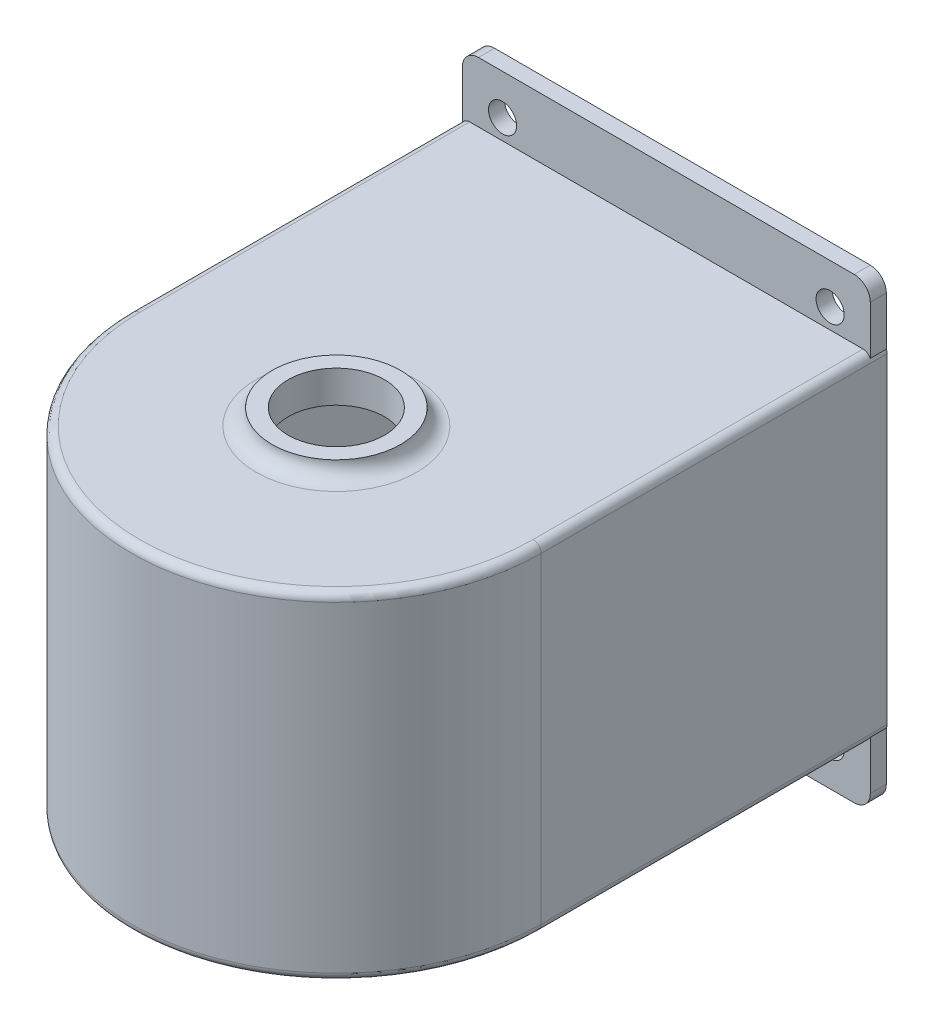
from build123d import *

# Parameters (mm, degrees)
BOSS_EXTRUDE1_DEPTH      = 21
BOSS_EXTRUDE1_DEPTH_BACK = 21
BOSS_EXTRUDE2_START      = -2
BOSS_EXTRUDE2_DEPTH      = 2
BOSS_EXTRUDE3_DEPTH      = 2
FILLET1_R                = 1
SKETCH12_R               = 8
SKETCH12_R_2             = 6
BOSS_EXTRUDE4_DEPTH      = 2
CUT_EXTRUDE1_START       = -11
SKETCH14_R               = 6
CUT_EXTRUDE1_DEPTH       = 11
FILLET2_R                = 2
SKETCH15_W               = 50.8
SKETCH15_H               = 57
BOSS_EXTRUDE5_DEPTH      = 2
FILLET3_R                = 2
SKETCH16_R               = 15
SKETCH16_R_2             = 7.05
CUT_EXTRUDE2_DEPTH       = 1
SKETCH16_3_R             = 7.05
CUT_EXTRUDE3_DEPTH       = 3
FILLET4_R                = 0.5
SKETCH17_R               = 1.75
CUT_EXTRUDE4_DEPTH       = 10


with BuildPart() as part:
    # Sketch7 → Boss-Extrude1 (new, two sides: drawn at the far end of the back side and taken through both)
    with BuildSketch(Plane(origin=(0, -3.5, 0), x_dir=(1, 0, 0), z_dir=(0, 1, 0)).offset(-BOSS_EXTRUDE1_DEPTH_BACK)):
        with BuildLine():
            Line((-23.5, 43.1), (-25.4, 43.1))
            Line((-25.4, 43.1), (-25.5, 43.1))
            Line((-25.5, 43.1), (-25.5, 0))
            ThreePointArc((-25.5, 0), (0, -25.5), (25.5, 0))
            Line((25.5, 0), (25.5, 43.1))
            Line((25.5, 43.1), (25.4, 43.1))
            Line((25.4, 43.1), (23.5, 43.1))
            Line((23.5, 43.1), (23.5, 0))
            ThreePointArc((23.5, 0), (0, -23.5), (-23.5, 0))
            Line((-23.5, 0), (-23.5, 43.1))
        make_face()
    extrude(amount=BOSS_EXTRUDE1_DEPTH + BOSS_EXTRUDE1_DEPTH_BACK)

    # Sketch8 → Boss-Extrude2 (add)
    with BuildSketch(Plane(origin=(0, 17.5, 0), x_dir=(1, 0, 0), z_dir=(0, 1, 0)).offset(BOSS_EXTRUDE2_START)):
        with BuildLine():
            Line((-25.5, 0), (-25.5, 43.1))
            Line((-25.5, 43.1), (25.5, 43.1))
            Line((25.5, 43.1), (25.5, 0))
            ThreePointArc((25.5, 0), (0, -25.5), (-25.5, 0))
        make_face()
    extrude(amount=BOSS_EXTRUDE2_DEPTH)

    # Sketch10 → Boss-Extrude3 (add)
    with BuildSketch(Plane.XZ.offset(24.5)):
        with BuildLine():
            Line((-23.5, 0), (-23.5, -43.1))
            Line((-23.5, -43.1), (23.5, -43.1))
            Line((23.5, -43.1), (23.5, 0))
            ThreePointArc((23.5, 0), (0, 23.5), (-23.5, 0))
        make_face()
        with BuildLine():
            ThreePointArc((25.5, 0), (0, 25.5), (-25.5, 0))
            Line((-25.5, 0), (-25.5, -43.1))
            Line((-25.5, -43.1), (-23.5, -43.1))
            Line((-23.5, -43.1), (-23.5, 0))
            ThreePointArc((-23.5, 0), (0, 23.5), (23.5, 0))
            Line((23.5, 0), (23.5, -43.1))
            Line((23.5, -43.1), (25.5, -43.1))
            Line((25.5, -43.1), (25.5, 0))
        make_face()
    extrude(amount=-BOSS_EXTRUDE3_DEPTH)

    # Fillet1
    fillet1_edges = [part.edges().sort_by_distance(p)[0] for p in [
        (0, 17.5, 25.5),
        (25.5, 17.5, -21.55),
        (25.5, -24.5, -21.55),
        (0, -24.5, 25.5),
        (-25.5, -24.5, -21.55),
        (0, 15.5, 23.5),
        (23.5, 15.5, -21.55),
        (-23.5, 15.5, -21.55),
        (-25.5, 17.5, -21.55),
        (23.5, -22.5, -21.55),
        (0, -22.5, 23.5),
        (-23.5, -22.5, -21.55),
    ]]
    fillet(fillet1_edges, radius=FILLET1_R)

    # Sketch12 → Boss-Extrude4 (add)
    with BuildSketch(Plane(origin=(0, 17.5, 0), x_dir=(1, 0, 0), z_dir=(0, 1, 0))):
        with Locations(Location((0, 0, 0), (0, 0, 270))):
            Circle(SKETCH12_R)
        with Locations(Location((0, 0, 0), (0, 0, 270))):
            Circle(SKETCH12_R_2, mode=Mode.SUBTRACT)
    extrude(amount=BOSS_EXTRUDE4_DEPTH)

    # Sketch14 → Cut-Extrude1 (cut)
    with BuildSketch(Plane(origin=(0, 17.5, 0), x_dir=(1, 0, 0), z_dir=(0, 1, 0)).offset(CUT_EXTRUDE1_START)):
        with Locations(Location((0, 0, 0), (0, 0, 270))):
            Circle(SKETCH14_R)
    extrude(amount=CUT_EXTRUDE1_DEPTH, mode=Mode.SUBTRACT)

    # Fillet2
    fillet2_edges = [part.edges().sort_by_distance(p)[0] for p in [
        (0, 17.5, -8),
    ]]
    fillet(fillet2_edges, radius=FILLET2_R - 0.0001)  # a hair under: the kernel refuses the full size

    # Sketch15 → Boss-Extrude5 (add)
    with BuildSketch(Plane.XY.offset(-43.1)):
        with Locations((0, -3.5)):
            Rectangle(SKETCH15_W, SKETCH15_H)
        with BuildLine():
            ThreePointArc((22.5, 15.5), (23.207106781, 15.207106781), (23.5, 14.5))
            Line((23.5, 14.5), (23.5, -21.5))
            ThreePointArc((23.5, -21.5), (23.207106781, -22.207106781), (22.5, -22.5))
            Line((22.5, -22.5), (-22.5, -22.5))
            ThreePointArc((-22.5, -22.5), (-23.207106781, -22.207106781), (-23.5, -21.5))
            Line((-23.5, -21.5), (-23.5, 14.5))
            ThreePointArc((-23.5, 14.5), (-23.207106781, 15.207106781), (-22.5, 15.5))
            Line((-22.5, 15.5), (22.5, 15.5))
        make_face(mode=Mode.SUBTRACT)
    extrude(amount=BOSS_EXTRUDE5_DEPTH)

    # Fillet3
    fillet3_edges = [part.edges().sort_by_distance(p)[0] for p in [
        (25.4, -32, -42.1),
        (-25.4, 25, -42.1),
        (-25.4, -32, -42.1),
        (25.4, 25, -42.1),
    ]]
    fillet(fillet3_edges, radius=FILLET3_R)

    # Sketch16 → Cut-Extrude2 (cut)
    # profile 1 of 2: a face of its own
    with BuildSketch(Plane.XZ.offset(24.5)):
        with Locations(Location((0, 0, 0), (0, 0, 270))):
            Circle(SKETCH16_R)
        Circle(SKETCH16_R_2, mode=Mode.SUBTRACT)
    # profile 2 of 2: a face of its own
    with BuildSketch(Plane.XZ.offset(24.5)):
        Circle(SKETCH16_R_2)
    extrude(amount=-CUT_EXTRUDE2_DEPTH, mode=Mode.SUBTRACT)

    # Sketch16<3> → Cut-Extrude3 (cut)
    with BuildSketch(Plane.XZ.offset(24.5)):
        with Locations(Location((0, 0, 0), (0, 0, 270))):
            Circle(SKETCH16_3_R)
    extrude(amount=-CUT_EXTRUDE3_DEPTH, mode=Mode.SUBTRACT)

    # Fillet4
    fillet4_edges = [part.edges().sort_by_distance(p)[0] for p in [
        (0, -23.5, 15),
        (0, -24.5, 15),
        (0, -22.5, 7.05),
        (0, -23.5, 7.05),
    ]]
    fillet(fillet4_edges, radius=FILLET4_R - 0.0001)  # a hair under: the kernel refuses the full size

    # Sketch17 → Cut-Extrude4 (cut)
    with BuildSketch(Plane(origin=(0, 0, -43.1), x_dir=(-1, 0, 0), z_dir=(0, 0, -1))):
        with Locations((-20.4, 20)):
            Circle(SKETCH17_R)
        with Locations((-20.4, -27)):
            Circle(SKETCH17_R)
        with Locations((20.4, -27)):
            Circle(SKETCH17_R)
        with Locations((20.4, 20)):
            Circle(SKETCH17_R)
    extrude(amount=-CUT_EXTRUDE4_DEPTH, mode=Mode.SUBTRACT)


solid = part.part
